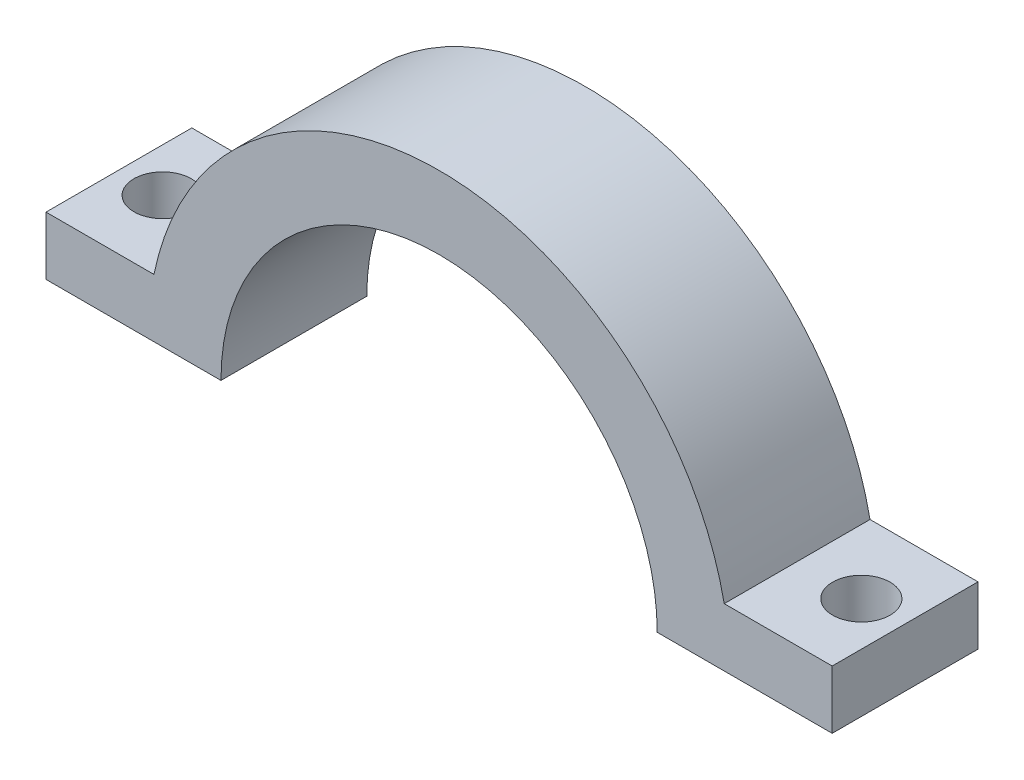
from build123d import *

# Parameters (mm, degrees)
SKETCH1_R                = 25.35
SKETCH1_R_2              = 19
BOSS_EXTRUDE1_DEPTH      = 12.7
BODY_DELETE_KEEP_1_DEPTH = 12.7
SKETCH2_W                = 15.24
SKETCH2_H                = 12.7
SKETCH2_R                = 2.5
BOSS_EXTRUDE2_DEPTH      = 5.08


# Read off the part's stored shape, not the designer's step: Body-Delete/Keep 1
with BuildPart() as part:
    # Sketch1 → Boss-Extrude1 (new body)
    with BuildSketch(Plane.XY):
        Circle(SKETCH1_R)
        Circle(SKETCH1_R_2, mode=Mode.SUBTRACT)
    extrude(amount=BOSS_EXTRUDE1_DEPTH)


with BuildPart() as body_2:
    # Split1: the piece on the far side of the plane
    add(part.part)
    split(bisect_by=Plane.ZX, keep=Keep.BOTTOM)

    # Body-Delete/Keep 1 outline → Body-Delete/Keep 1 (cut)
    with BuildSketch(Plane.XY):
        with BuildLine():
            ThreePointArc((-25.35, 0), (0, -25.35), (25.35, 0))
            Line((25.35, 0), (19, 0))
            ThreePointArc((19, 0), (0, -19), (-19, 0))
            Line((-19, 0), (-25.35, 0))
        make_face()
    extrude(amount=BODY_DELETE_KEEP_1_DEPTH, mode=Mode.SUBTRACT)


with BuildPart() as part_1:
    add(part.part)

    # Split1
    split(bisect_by=Plane.ZX, keep=Keep.TOP)

    # Sketch2 → Boss-Extrude2 (add)
    # profile 1 of 2: a face of its own
    with BuildSketch(Plane.XZ):
        with Locations((26.62, 6.35)):
            Rectangle(SKETCH2_W, SKETCH2_H)
        with Locations(Location((30.43, 6.35, 0), (0, 0, 270))):
            Circle(SKETCH2_R, mode=Mode.SUBTRACT)
    # profile 2 of 2: a face of its own
    with BuildSketch(Plane.XZ):
        with Locations((-26.62, 6.35)):
            Rectangle(SKETCH2_W, SKETCH2_H)
        with Locations(Location((-30.43, 6.35, 0), (0, 0, 90))):
            Circle(SKETCH2_R, mode=Mode.SUBTRACT)
    extrude(amount=-BOSS_EXTRUDE2_DEPTH)


solid = part_1.part
